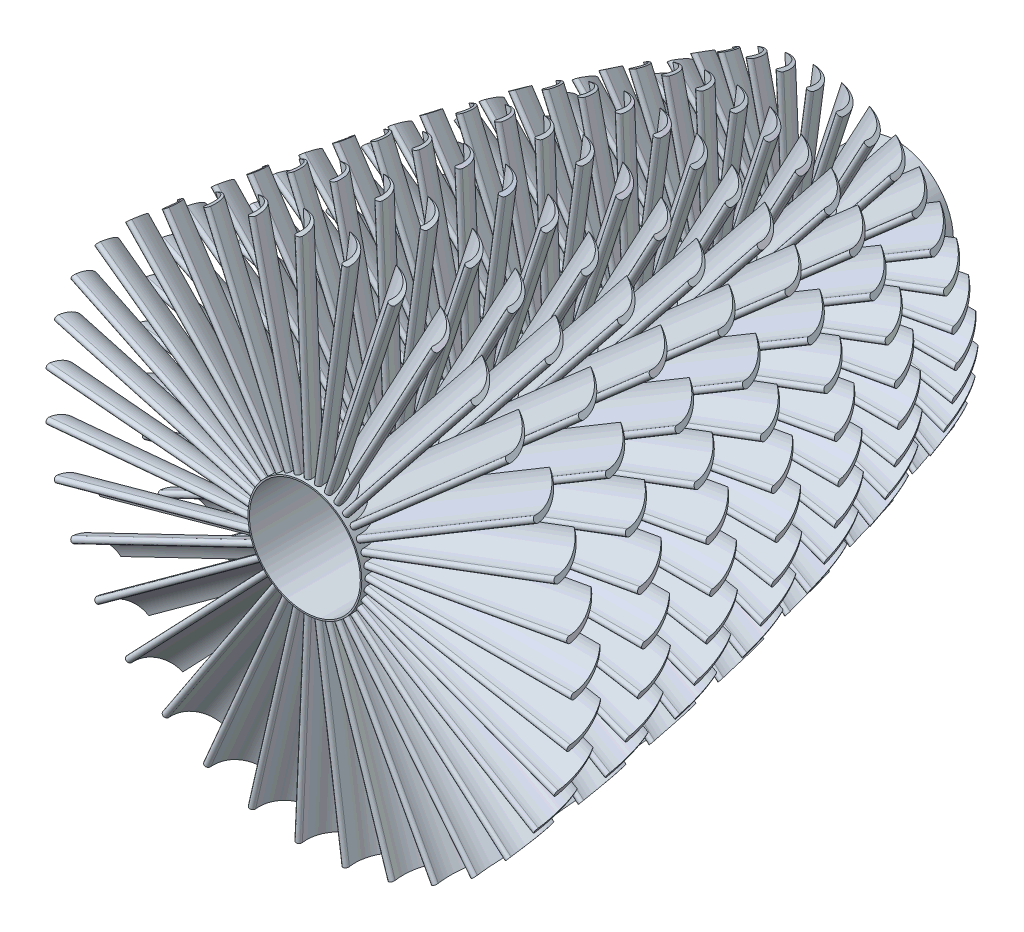
from build123d import *

# Parameters (mm, degrees)
SKETCH1_R                = 7.7
SKETCH1_R_2              = 7.5
EXTRUDE_THIN1_DEPTH      = 80
BOSS_EXTRUDE1_REACH      = 101.642
BOSS_EXTRUDE1_END_RADIUS = 7.7
LPATTERN1_COUNT          = 7
LPATTERN1_PITCH          = 10.75
CIRPATTERN1_COUNT        = 35
CIRPATTERN1_2_COUNT      = 35
CIRPATTERN1_3_COUNT      = 35
CIRPATTERN1_4_COUNT      = 35
CIRPATTERN1_5_COUNT      = 35
CIRPATTERN1_6_COUNT      = 35
CIRPATTERN1_7_COUNT      = 35


with BuildPart() as part:
    # Sketch1 → Extrude-Thin1 (new body)
    with BuildSketch(Plane.XY):
        Circle(SKETCH1_R)
        Circle(SKETCH1_R_2, mode=Mode.SUBTRACT)
    extrude(amount=EXTRUDE_THIN1_DEPTH)


with BuildPart() as body_2:
    # Boss-Extrude1: up to this cylinder (the profile starts outside it)
    boss_extrude1_end = Plane(origin=(0, 0, 77.566297), z_dir=(0, 0, -1)) * Cylinder(BOSS_EXTRUDE1_END_RADIUS, 219.684, mode=Mode.PRIVATE)
    # Sketch3 → Boss-Extrude1 (new, up to the surface)
    with BuildSketch(Plane(origin=(51.2, 0, 0), x_dir=(0, 0, -1), z_dir=(1, 0, 0)), mode=Mode.PRIVATE) as boss_extrude1_sk1:
        with BuildLine():
            Line((-75, 3.64), (-75, 3.45))
            ThreePointArc((-75, 3.45), (-76.387914174, 0.787775646), (-79.141362125, -0.408998621))
            ThreePointArc((-79.141362125, -0.408998621), (-79.579988982, -0.003005735), (-79.14736183, 0.409374539))
            ThreePointArc((-79.14736183, 0.409374539), (-76.468417049, 1.247671089), (-75, 3.64))
        make_face()
    boss_extrude1_tool1 = extrude(boss_extrude1_sk1.sketch, amount=-BOSS_EXTRUDE1_REACH, mode=Mode.PRIVATE) - boss_extrude1_end
    add(boss_extrude1_tool1.solids().sort_by_distance((51.2, 0.598303, 77.566297))[0])


with BuildPart() as lpattern1_1:
    # LPattern1: pattern copy
    add(body_2.part.moved(Location(Vector(0, 0, -1) * (1 * LPATTERN1_PITCH))))


with BuildPart() as lpattern1_2:
    # LPattern1: pattern copy
    add(body_2.part.moved(Location(Vector(0, 0, -1) * (2 * LPATTERN1_PITCH))))


with BuildPart() as lpattern1_3:
    # LPattern1: pattern copy
    add(body_2.part.moved(Location(Vector(0, 0, -1) * (3 * LPATTERN1_PITCH))))


with BuildPart() as lpattern1_4:
    # LPattern1: pattern copy
    add(body_2.part.moved(Location(Vector(0, 0, -1) * (4 * LPATTERN1_PITCH))))


with BuildPart() as lpattern1_5:
    # LPattern1: pattern copy
    add(body_2.part.moved(Location(Vector(0, 0, -1) * (5 * LPATTERN1_PITCH))))


with BuildPart() as lpattern1_6:
    # LPattern1: pattern copy
    add(body_2.part.moved(Location(Vector(0, 0, -1) * (6 * LPATTERN1_PITCH))))


with BuildPart() as cut_revolve1_tool:
    # Sketch4 → Cut-Revolve1 (revolve)
    with BuildSketch(Plane(origin=(0, 0, 0), x_dir=(1, 0, 0), z_dir=(0, 1, 0))):
        with BuildLine():
            Line((18, 0), (78.84310247, 0))
            Line((78.84310247, 0), (78.84310247, -88.781922226))
            Line((78.84310247, -88.781922226), (36.3, -88.781922226))
            ThreePointArc((36.3, -88.781922226), (30.202793365, -43.761710054), (18, 0))
        make_face()
    revolve(axis=Axis((0, 0, 0), (0, 0, 1)))


with BuildPart() as body_2_1:
    add(body_2.part)

    # Cut-Revolve1: cut by cut_revolve1_tool
    add(cut_revolve1_tool.part, mode=Mode.SUBTRACT)

    # CirPattern1 7: body 2 ×35 about axis
    cirpattern1_7_axis = Axis((0, 0, 0), (0, 0, 1))


with BuildPart() as lpattern1_1_1:
    add(lpattern1_1.part)

    # Cut-Revolve1: cut by cut_revolve1_tool
    add(cut_revolve1_tool.part, mode=Mode.SUBTRACT)

    # CirPattern1 6: LPattern1_1 ×35 about axis
    cirpattern1_6_axis = Axis((0, 0, 0), (0, 0, 1))


with BuildPart() as lpattern1_2_1:
    add(lpattern1_2.part)

    # Cut-Revolve1: cut by cut_revolve1_tool
    add(cut_revolve1_tool.part, mode=Mode.SUBTRACT)

    # CirPattern1 5: LPattern1_2 ×35 about axis
    cirpattern1_5_axis = Axis((0, 0, 0), (0, 0, 1))


with BuildPart() as lpattern1_3_1:
    add(lpattern1_3.part)

    # Cut-Revolve1: cut by cut_revolve1_tool
    add(cut_revolve1_tool.part, mode=Mode.SUBTRACT)

    # CirPattern1 4: LPattern1_3 ×35 about axis
    cirpattern1_4_axis = Axis((0, 0, 0), (0, 0, 1))


with BuildPart() as lpattern1_4_1:
    add(lpattern1_4.part)

    # Cut-Revolve1: cut by cut_revolve1_tool
    add(cut_revolve1_tool.part, mode=Mode.SUBTRACT)

    # CirPattern1 3: LPattern1_4 ×35 about axis
    cirpattern1_3_axis = Axis((0, 0, 0), (0, 0, 1))


with BuildPart() as lpattern1_5_1:
    add(lpattern1_5.part)

    # Cut-Revolve1: cut by cut_revolve1_tool
    add(cut_revolve1_tool.part, mode=Mode.SUBTRACT)

    # CirPattern1 2: LPattern1_5 ×35 about axis
    cirpattern1_2_axis = Axis((0, 0, 0), (0, 0, 1))


with BuildPart() as lpattern1_6_1:
    add(lpattern1_6.part)

    # Cut-Revolve1: cut by cut_revolve1_tool
    add(cut_revolve1_tool.part, mode=Mode.SUBTRACT)

    # CirPattern1: LPattern1_6 ×35 about axis
    cirpattern1_axis = Axis((0, 0, 0), (0, 0, 1))


with BuildPart() as lpattern1_6_2:
    add(lpattern1_6_1.part)
    for i in range(1, CIRPATTERN1_COUNT):
        add(lpattern1_6_1.part.rotate(cirpattern1_axis, i * 360 / CIRPATTERN1_COUNT))


with BuildPart() as lpattern1_5_2:
    add(lpattern1_5_1.part)
    for i in range(1, CIRPATTERN1_2_COUNT):
        add(lpattern1_5_1.part.rotate(cirpattern1_2_axis, i * 360 / CIRPATTERN1_2_COUNT))


with BuildPart() as lpattern1_4_2:
    add(lpattern1_4_1.part)
    for i in range(1, CIRPATTERN1_3_COUNT):
        add(lpattern1_4_1.part.rotate(cirpattern1_3_axis, i * 360 / CIRPATTERN1_3_COUNT))


with BuildPart() as lpattern1_3_2:
    add(lpattern1_3_1.part)
    for i in range(1, CIRPATTERN1_4_COUNT):
        add(lpattern1_3_1.part.rotate(cirpattern1_4_axis, i * 360 / CIRPATTERN1_4_COUNT))


with BuildPart() as lpattern1_2_2:
    add(lpattern1_2_1.part)
    for i in range(1, CIRPATTERN1_5_COUNT):
        add(lpattern1_2_1.part.rotate(cirpattern1_5_axis, i * 360 / CIRPATTERN1_5_COUNT))


with BuildPart() as lpattern1_1_2:
    add(lpattern1_1_1.part)
    for i in range(1, CIRPATTERN1_6_COUNT):
        add(lpattern1_1_1.part.rotate(cirpattern1_6_axis, i * 360 / CIRPATTERN1_6_COUNT))


with BuildPart() as body_2_2:
    add(body_2_1.part)
    for i in range(1, CIRPATTERN1_7_COUNT):
        add(body_2_1.part.rotate(cirpattern1_7_axis, i * 360 / CIRPATTERN1_7_COUNT))


solid = Compound([part.part, lpattern1_6_2.part, lpattern1_5_2.part, lpattern1_4_2.part, lpattern1_3_2.part, lpattern1_2_2.part, lpattern1_1_2.part, body_2_2.part])
